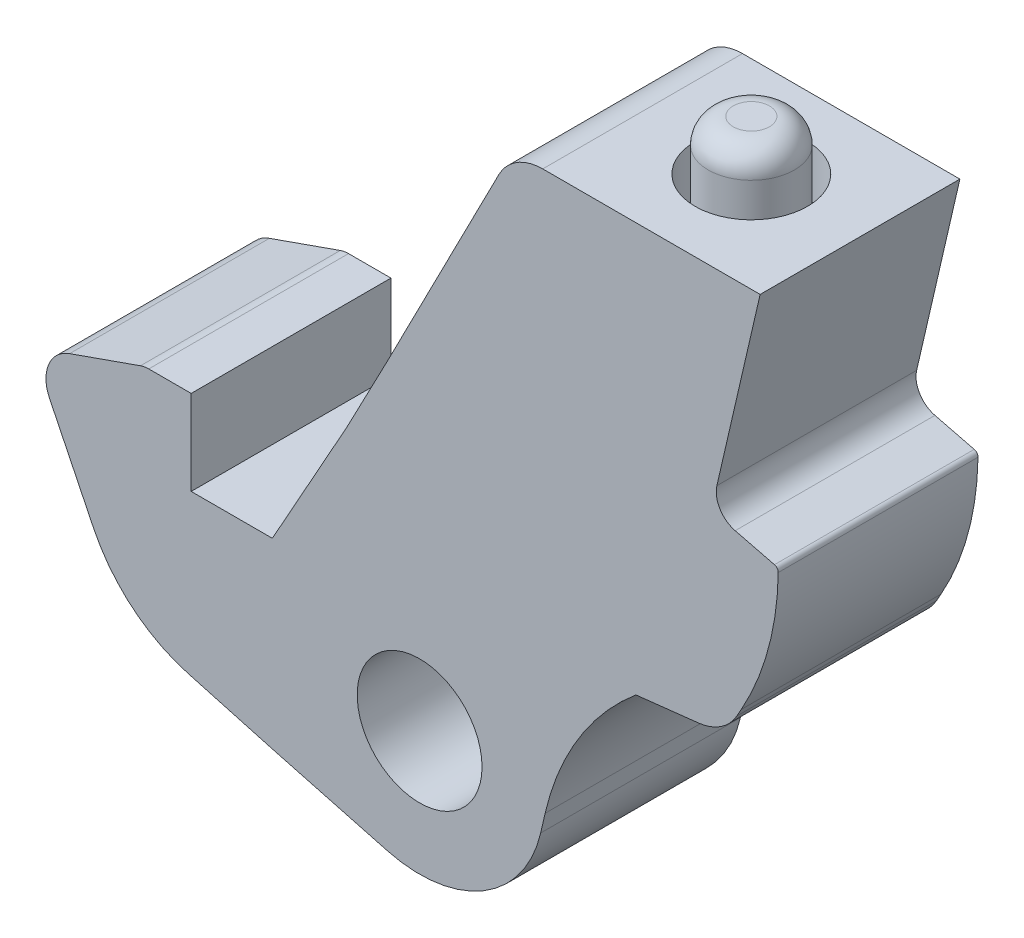
from build123d import *

# Parameters (mm, degrees)
SKETCH_2_R          = 2.5
EXTRUDE_1_DEPTH     = 8
SKETCH_9_R          = 2.25
CUT_EXTRUDE_6_DEPTH = 2
SKETCH_10_R         = 1.725
EXTRUDE_3_DEPTH     = 4
FILLET_9_R          = 1


with BuildPart() as part:
    # 스케치2 → 보스-돌출1 (new body)
    with BuildSketch(Plane.XY):
        with BuildLine():
            Line((8.110834425, 16.097889016), (13.7243035, 16.097889016))
            Line((13.7243035, 16.097889016), (16.816985044, 16.097889016))
            Line((16.816985044, 16.097889016), (15.084656802, 8.597889016))
            ThreePointArc((15.084656802, 8.597889016), (15.206408871, 7.850264523), (15.817350766, 7.402474448))
            Line((15.817350766, 7.402474448), (17.390570866, 7.010689941))
            ThreePointArc((17.390570866, 7.010689941), (17.500672103, 6.938680336), (17.542221223, 6.813855113))
            ThreePointArc((17.542221223, 6.813855113), (17.145611655, 3.974809178), (16.059003603, 1.322119239))
            Line((16.059003603, 1.322119239), (15.880215938, 1.005294634))
            ThreePointArc((15.880215938, 1.005294634), (15.241570396, 0.319965923), (14.360908016, 0.000627007))
            Line((14.360908016, 0.000627007), (11.842329465, -0.281306687))
            ThreePointArc((11.842329465, -0.281306687), (9.540393744, -2.945925202), (8.205466836, -6.204309777))
            Line((8.205466836, -6.204309777), (8.026484839, -6.979200437))
            ThreePointArc((8.026484839, -6.979200437), (5.744622673, -10.122081886), (1.899177239, -10.667194879))
            Line((1.899177239, -10.667194879), (-2.713922879, -9.439136425))
            Line((-2.713922879, -9.439136425), (-6.086658366, -8.506851574))
            ThreePointArc((-6.086658366, -8.506851574), (-8.323670203, -7.337653763), (-9.881865945, -5.351886527))
            Line((-9.881865945, -5.351886527), (-11.641875294, -1.739829609))
            ThreePointArc((-11.641875294, -1.739829609), (-11.678836202, -0.582101362), (-10.839032567, 0.21566468))
            Line((-10.839032567, 0.21566468), (-7.999803479, 1.214399245))
            ThreePointArc((-7.999803479, 1.214399245), (-7.836289234, 1.256793405), (-7.667972201, 1.271060492))
            Line((-7.667972201, 1.271060492), (-5.969536129, 1.271060492))
            Line((-5.969536129, 1.271060492), (-5.969536129, -2.128939508))
            Line((-5.969536129, -2.128939508), (-2.719228104, -2.128939508))
            Line((-2.719228104, -2.128939508), (0.263428455, 3.212901926))
            Line((0.263428455, 3.212901926), (1.899177239, 6.340694334))
            Line((1.899177239, 6.340694334), (6.353575322, 15.024331657))
            ThreePointArc((6.353575322, 15.024331657), (7.081212534, 15.808263097), (8.110834425, 16.097889016))
        make_face()
        with Locations((3.179026074, -5.859548474)):
            Circle(SKETCH_2_R, mode=Mode.SUBTRACT)
    extrude(amount=EXTRUDE_1_DEPTH)

    # 스케치9 → 컷-돌출6 (cut)
    with BuildSketch(Plane(origin=(0, 16.097889016, 0), x_dir=(1, 0, 0), z_dir=(0, 1, 0))):
        with Locations((12.463909735, -4)):
            Circle(SKETCH_9_R)
    extrude(amount=-CUT_EXTRUDE_6_DEPTH, mode=Mode.SUBTRACT)

    # 스케치10 → 보스-돌출3 (add)
    with BuildSketch(Plane(origin=(0, 14.097889016, 0), x_dir=(1, 0, 0), z_dir=(0, 1, 0))):
        with Locations((12.463909735, -4)):
            Circle(SKETCH_10_R)
    extrude(amount=EXTRUDE_3_DEPTH)

    # 필렛9
    fillet_9_edges = [part.edges().sort_by_distance(p)[0] for p in [
        (10.738909735, 18.097889016, 4),
    ]]
    fillet(fillet_9_edges, radius=FILLET_9_R)


solid = part.part
